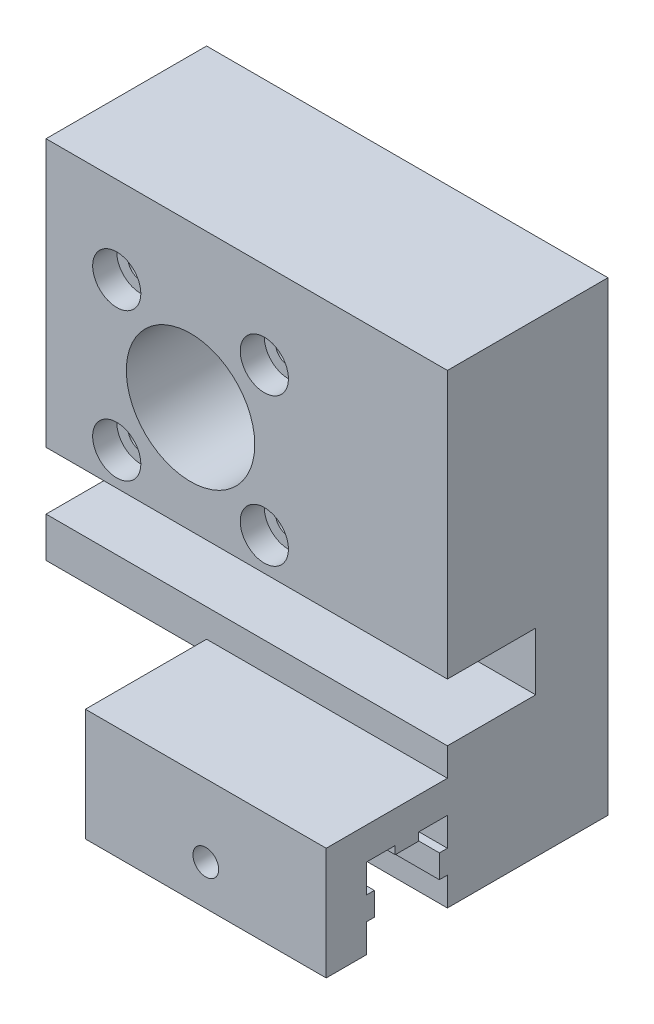
from build123d import *

# Parameters (mm, degrees)
ESQUISSE1_W                     = 50
ESQUISSE1_H                     = 45
MAIN_EXTRUSION_DEPTH            = 20
ESQUISSE5_R                     = 8
GEAR_LINEAR_HOLES_DEPTH         = 40.131189606
FIXING_EXTRUSION_DEPTH          = 25
ESQUISSE13_W                    = 50
ESQUISSE13_H                    = 7.2
ROLLINGBALLHORIZONTALHOLE_DEPTH = 11
FRONTHOLE_DEPTH                 = 20
ESQUISSE15_R                    = 1.6
BOTTOMFIXINGHOLE_DEPTH          = 56.832427853
ESQUISSE12_R                    = 16
REDUCTORMAINHOLE_DEPTH          = 5
REDUCTORFRONTFIXINGHOLE_DEPTH   = 3
ESQUISSE17_R                    = 1.6
MOTORFIXINGHOLE_DEPTH           = 53.832376437
ESQUISSE19_R                    = 3
ENL_V_MAT_EXTRU_5_DEPTH         = 3


with BuildPart() as part:
    # Esquisse1 → Main Extrusion (new body)
    with BuildSketch(Plane.XY):
        Rectangle(ESQUISSE1_W, ESQUISSE1_H)
    extrude(amount=MAIN_EXTRUSION_DEPTH)

    # Esquisse5 → Gear Linear Holes (cut, through all)
    with BuildSketch(Plane.XY.offset(20)):
        with Locations((-7, 2.5)):
            Circle(ESQUISSE5_R)
    extrude(amount=-GEAR_LINEAR_HOLES_DEPTH, mode=Mode.SUBTRACT)

    # Esquisse8 → Fixing Extrusion (add, symmetric)
    with BuildSketch(Plane(origin=(0, 0, 0), x_dir=(0, 0, -1), z_dir=(1, 0, 0))):
        Polygon((-20, -25.5), (-20, -29.05), (-21, -29.05), (-21, -31.95), (-20, -31.95), (-20, -35.5), (0, -35.5), (0, -21.5), (-35.1, -21.5), (-35.1, -35.5), (-30.1, -35.5), (-30.1, -31.95), (-29.1, -31.95), (-29.1, -29.05), (-30.1, -29.05), (-30.1, -25.5), (-26.5, -25.5), (-26.5, -26.5), (-23.6, -26.5), (-23.6, -25.5), align=None)
    extrude(amount=FIXING_EXTRUSION_DEPTH, both=True)

    # Esquisse13 → RollingBallHorizontalHole (cut)
    with BuildSketch(Plane.XY.offset(20)):
        with Locations((0, -14.4)):
            Rectangle(ESQUISSE13_W, ESQUISSE13_H)
    extrude(amount=-ROLLINGBALLHORIZONTALHOLE_DEPTH, mode=Mode.SUBTRACT)

    # Esquisse14 → FrontHole (cut)
    with BuildSketch(Plane.ZY.offset(25)):
        Polygon((0, -23), (20, -23), (20, -18), (35.1, -18), (35.1, -35.5), (0, -35.5), align=None)
    extrude(amount=-FRONTHOLE_DEPTH, mode=Mode.SUBTRACT)

    # Esquisse15 → BottomFixingHole (cut, through all)
    with BuildSketch(Plane.XY.offset(35.1)):
        with Locations((10, -30.5)):
            Circle(ESQUISSE15_R)
    extrude(amount=-BOTTOMFIXINGHOLE_DEPTH, mode=Mode.SUBTRACT)

    # Esquisse12 → ReductorMainHole (cut)
    with BuildSketch(Plane.XY):
        with Locations((-7, 2.5)):
            Circle(ESQUISSE12_R)
    extrude(amount=REDUCTORMAINHOLE_DEPTH, mode=Mode.SUBTRACT)

    # Esquisse16 → ReductorFrontFixingHole (cut)
    with BuildSketch(Plane(origin=(0, 0, 5), x_dir=(-1, 0, 0), z_dir=(0, 0, -1))):
        with BuildLine():
            Line((2.641101056, 11.5), (11.358898944, 11.5))
            ThreePointArc((11.358898944, 11.5), (17, 2.5), (11.358898944, -6.5))
            Line((11.358898944, -6.5), (2.641101056, -6.5))
            ThreePointArc((2.641101056, -6.5), (-3, 2.5), (2.641101056, 11.5))
        make_face()
    extrude(amount=-REDUCTORFRONTFIXINGHOLE_DEPTH, mode=Mode.SUBTRACT)

    # Esquisse17 → MotorFixingHole (cut, through all)
    with BuildSketch(Plane(origin=(0, 0, 5), x_dir=(-1, 0, 0), z_dir=(0, 0, -1))):
        with Locations((-2.192388155, 11.692388155)):
            Circle(ESQUISSE17_R)
        with Locations((16.192388155, 11.692388155)):
            Circle(ESQUISSE17_R)
        with Locations((-2.192388155, -6.692388155)):
            Circle(ESQUISSE17_R)
        with Locations((16.192388155, -6.692388155)):
            Circle(ESQUISSE17_R)
    extrude(amount=-MOTORFIXINGHOLE_DEPTH, mode=Mode.SUBTRACT)

    # Esquisse19 → Enlèv. mat.-Extru.5 (cut)
    with BuildSketch(Plane.XY.offset(20)):
        with Locations((-16.192388155, 11.692388155)):
            Circle(ESQUISSE19_R)
        with Locations((2.192388155, 11.692388155)):
            Circle(ESQUISSE19_R)
        with Locations((-16.192388155, -6.692388155)):
            Circle(ESQUISSE19_R)
        with Locations((2.192388155, -6.692388155)):
            Circle(ESQUISSE19_R)
    extrude(amount=-ENL_V_MAT_EXTRU_5_DEPTH, mode=Mode.SUBTRACT)


solid = part.part
